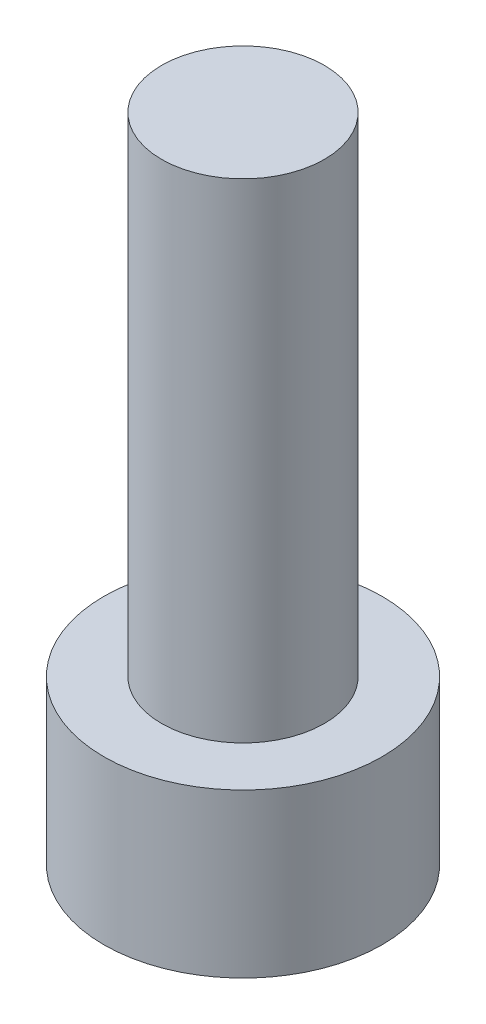
from build123d import *

# Parameters (mm, degrees)
SKETCH1_R           = 3.415
BOSS_EXTRUDE1_DEPTH = 4
SKETCH2_R           = 2
BOSS_EXTRUDE2_DEPTH = 12


with BuildPart() as part:
    # Sketch1 → Boss-Extrude1 (new body)
    with BuildSketch(Plane(origin=(0, 0, 0), x_dir=(1, 0, 0), z_dir=(0, 1, 0))):
        Circle(SKETCH1_R)
    extrude(amount=BOSS_EXTRUDE1_DEPTH)

    # Sketch2 → Boss-Extrude2 (add)
    with BuildSketch(Plane(origin=(0, 4, 0), x_dir=(1, 0, 0), z_dir=(0, 1, 0))):
        Circle(SKETCH2_R)
    extrude(amount=BOSS_EXTRUDE2_DEPTH)


solid = part.part
